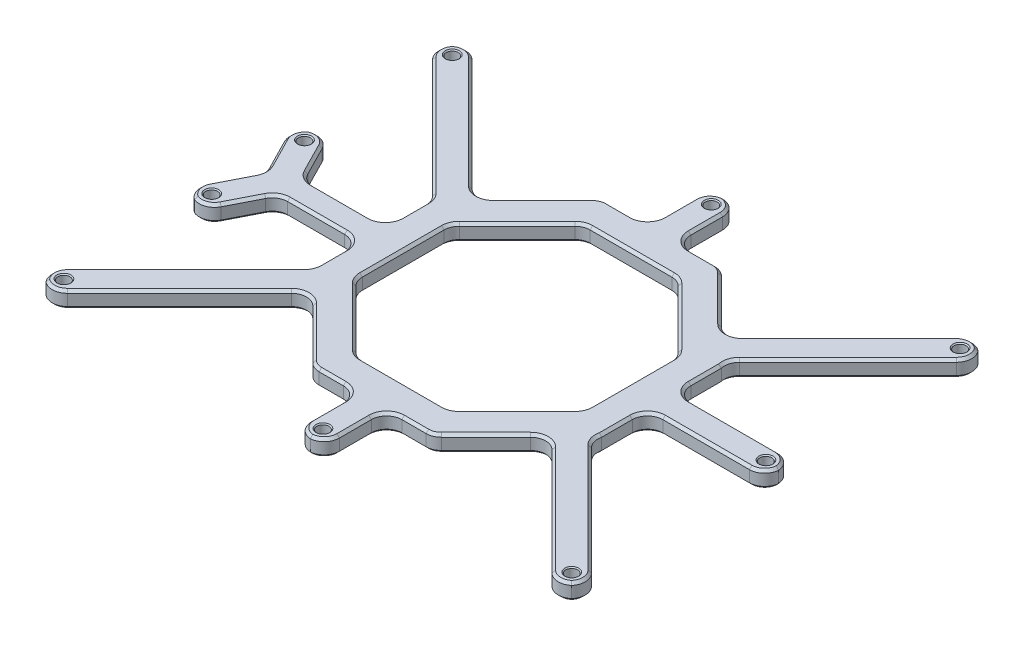
from build123d import *

# Parameters (mm, degrees)
BOSS_EXTRUDE1_DEPTH = 6.5
CUT_EXTRUDE2_START  = 6.5
SKETCH1_3_R         = 2.35
CUT_EXTRUDE2_DEPTH  = 4
SKETCH2_R           = 2.35
CUT_EXTRUDE1_DEPTH  = 4
FILLET1_START       = -1
FILLET1_DEPTH       = 8
FILLET1_2_DEPTH     = 6.5
CHAMFER1_SIZE       = 0.4
CHAMFER2_SIZE       = 1


with BuildPart() as part:
    # Sketch1 → Boss-Extrude1 (new body)
    with BuildSketch(Plane(origin=(0, 0, 0), x_dir=(1, 0, 0), z_dir=(0, 1, 0))):
        Polygon((49.938523544, -21.19426647), (31.907300624, -21.19426647), (31.907300624, 3.371336017), (20.907300624, 3.371336017), (20.907300624, -21.19426647), (2.876077704, -21.19426647), (-22.623922296, -46.69426647), (-75.114145985, 5.795957219), (-82.892320578, -1.982217374), (-30.402096889, -54.472441063), (-30.402096889, -73.003663983), (-62.531331672, -73.003663983), (-72.841447163, -52.800046269), (-82.639406134, -57.800046269), (-72.329290643, -78.003663983), (-82.639406134, -98.207281697), (-72.841447163, -103.207281697), (-62.531331672, -83.003663983), (-30.402096889, -83.003663983), (-30.402096889, -101.534886904), (-82.892320578, -154.025110593), (-75.114145985, -161.803285186), (-22.623922296, -109.313061497), (2.876077704, -134.813061497), (20.907300624, -134.813061497), (20.907300624, -159.378663983), (31.907300624, -159.378663983), (31.907300624, -134.813061497), (49.938523544, -134.813061497), (73.438523544, -111.313061497), (123.928747234, -161.803285186), (131.706921827, -154.025110593), (81.216698138, -103.534886904), (83.216698138, -101.534886904), (83.216698138, -83.503663983), (129.282300624, -83.503663983), (129.282300624, -72.503663983), (83.216698138, -72.503663983), (83.216698138, -54.472441063), (81.216698138, -52.472441063), (131.706921827, -1.982217374), (123.928747234, 5.795957219), (73.438523544, -44.69426647), align=None)
        Polygon((7.846640452, -33.19426647), (44.967960796, -33.19426647), (71.216698138, -59.443003812), (71.216698138, -96.564324155), (44.967960796, -122.813061497), (7.846640452, -122.813061497), (-18.402096889, -96.564324155), (-18.402096889, -59.443003812), align=None, mode=Mode.SUBTRACT)
    extrude(amount=BOSS_EXTRUDE1_DEPTH)

    # Sketch1<3> → Cut-Extrude2 (cut)
    with BuildSketch(Plane(origin=(0, 0, 0), x_dir=(1, 0, 0), z_dir=(0, 1, 0)).offset(CUT_EXTRUDE2_START)):
        with Locations(Location((-75.467699376, -96.253663983, 0), (0, 0, 270))):
            Circle(SKETCH1_3_R)
        with Locations(Location((-75.467699376, -154.378663983, 0), (0, 0, 270))):
            Circle(SKETCH1_3_R)
        with Locations(Location((26.407300624, -154.378663983, 0), (0, 0, 270))):
            Circle(SKETCH1_3_R)
        with Locations(Location((124.282300624, -154.378663983, 0), (0, 0, 270))):
            Circle(SKETCH1_3_R)
        with Locations(Location((124.282300624, -78.003663983, 0), (0, 0, 270))):
            Circle(SKETCH1_3_R)
        with Locations(Location((124.282300624, -1.628663983, 0), (0, 0, 270))):
            Circle(SKETCH1_3_R)
        with Locations(Location((26.407300624, -1.628663983, 0), (0, 0, 270))):
            Circle(SKETCH1_3_R)
        with Locations(Location((-75.467699376, -1.628663983, 0), (0, 0, 270))):
            Circle(SKETCH1_3_R)
        with Locations(Location((-75.467699376, -59.753663983, 0), (0, 0, 270))):
            Circle(SKETCH1_3_R)
    extrude(amount=-CUT_EXTRUDE2_DEPTH, mode=Mode.SUBTRACT)

    # Sketch2 → Cut-Extrude1 (cut)
    with BuildSketch(Plane.XZ):
        with Locations(Location((-7.920615679, 115.53108674, 0), (0, 0, 270))):
            Circle(SKETCH2_R)
        with Locations(Location((89.06313323, 78.003663983, 0), (0, 0, 270))):
            Circle(SKETCH2_R)
        with Locations(Location((-7.920615679, 40.476241227, 0), (0, 0, 270))):
            Circle(SKETCH2_R)
    extrude(amount=-CUT_EXTRUDE1_DEPTH, mode=Mode.SUBTRACT)

    # Fillet1: read off the stored shape, not the designer's step
    # Fillet1 outline → Fillet1 (cut)
    with BuildSketch(Plane(origin=(0, 0, 0), x_dir=(1, 0, 0), z_dir=(0, 1, 0)).offset(FILLET1_START)):
        with BuildLine():
            ThreePointArc((26.407300624, -159.357794355), (22.491420191, -157.440683186), (20.907300624, -153.378663983))
            Line((20.907300624, -153.378663983), (20.907300624, -159.378663983))
            Line((20.907300624, -159.378663983), (31.907300624, -159.378663983))
            Line((31.907300624, -159.378663983), (31.907300624, -153.378663983))
            ThreePointArc((31.907300624, -153.378663983), (30.323181057, -157.440683186), (26.407300624, -159.357794355))
        make_face()
        with BuildLine():
            Line((2.876077704, -134.813061497), (5.361359078, -134.813061497))
            ThreePointArc((5.361359078, -134.813061497), (3.065258484, -134.356338692), (1.118718391, -133.055702184))
            Line((1.118718391, -133.055702184), (2.876077704, -134.813061497))
        make_face()
        with BuildLine():
            Line((-75.114145985, -161.803285186), (-70.871505298, -157.560644499))
            ThreePointArc((-70.871505298, -157.560644499), (-74.863928309, -159.312784134), (-78.988476226, -157.899440833))
            ThreePointArc((-78.988476226, -157.899440833), (-80.401819526, -153.774892917), (-78.649679891, -149.782469906))
            Line((-78.649679891, -149.782469906), (-82.892320578, -154.025110593))
            Line((-82.892320578, -154.025110593), (-75.114145985, -161.803285186))
        make_face()
        with BuildLine():
            ThreePointArc((51.695882857, -133.055702184), (49.749342764, -134.356338692), (47.45324217, -134.813061497))
            Line((47.45324217, -134.813061497), (49.938523544, -134.813061497))
            Line((49.938523544, -134.813061497), (51.695882857, -133.055702184))
        make_face()
        with BuildLine():
            ThreePointArc((127.803077474, -157.899440833), (123.678529558, -159.312784134), (119.686106547, -157.560644499))
            Line((119.686106547, -157.560644499), (123.928747234, -161.803285186))
            Line((123.928747234, -161.803285186), (131.706921827, -154.025110593))
            Line((131.706921827, -154.025110593), (127.46428114, -149.782469906))
            ThreePointArc((127.46428114, -149.782469906), (129.216420775, -153.774892917), (127.803077474, -157.899440833))
        make_face()
        with BuildLine():
            Line((-72.841447163, -103.207281697), (-70.114174436, -97.86294044))
            ThreePointArc((-70.114174436, -97.86294044), (-73.371559393, -100.761022227), (-77.730940454, -100.688692628))
            ThreePointArc((-77.730940454, -100.688692628), (-80.347493179, -97.201130924), (-79.912133407, -92.86294044))
            Line((-79.912133407, -92.86294044), (-82.639406134, -98.207281697))
            Line((-82.639406134, -98.207281697), (-72.841447163, -103.207281697))
        make_face()
        with BuildLine():
            ThreePointArc((129.261430996, -78.003663983), (127.344319827, -81.919544416), (123.282300624, -83.503663983))
            Line((123.282300624, -83.503663983), (129.282300624, -83.503663983))
            Line((129.282300624, -83.503663983), (129.282300624, -72.503663983))
            Line((129.282300624, -72.503663983), (123.282300624, -72.503663983))
            ThreePointArc((123.282300624, -72.503663983), (127.344319827, -74.08778355), (129.261430996, -78.003663983))
        make_face()
        with BuildLine():
            Line((-82.639406134, -57.800046269), (-79.912133407, -63.144387526))
            ThreePointArc((-79.912133407, -63.144387526), (-80.347493179, -58.806197043), (-77.730940454, -55.318635339))
            ThreePointArc((-77.730940454, -55.318635339), (-73.371559394, -55.24630574), (-70.114174436, -58.144387526))
            Line((-70.114174436, -58.144387526), (-72.841447163, -52.800046269))
            Line((-72.841447163, -52.800046269), (-82.639406134, -57.800046269))
        make_face()
        with BuildLine():
            ThreePointArc((127.803077474, 1.892112867), (129.216420775, -2.23243505), (127.46428114, -6.224858061))
            Line((127.46428114, -6.224858061), (131.706921827, -1.982217374))
            Line((131.706921827, -1.982217374), (123.928747234, 5.795957219))
            Line((123.928747234, 5.795957219), (119.686106547, 1.553316532))
            ThreePointArc((119.686106547, 1.553316532), (123.678529558, 3.305456167), (127.803077474, 1.892112867))
        make_face()
        with BuildLine():
            Line((-82.892320578, -1.982217374), (-78.649679891, -6.224858061))
            ThreePointArc((-78.649679891, -6.224858061), (-80.401819526, -2.23243505), (-78.988476226, 1.892112867))
            ThreePointArc((-78.988476226, 1.892112867), (-74.863928309, 3.305456167), (-70.871505298, 1.553316532))
            Line((-70.871505298, 1.553316532), (-75.114145985, 5.795957219))
            Line((-75.114145985, 5.795957219), (-82.892320578, -1.982217374))
        make_face()
        with BuildLine():
            ThreePointArc((47.45324217, -21.19426647), (49.749342764, -21.650989275), (51.695882857, -22.951625783))
            Line((51.695882857, -22.951625783), (49.938523544, -21.19426647))
            Line((49.938523544, -21.19426647), (47.45324217, -21.19426647))
        make_face()
        with BuildLine():
            ThreePointArc((26.407300624, 3.350466388), (30.323181057, 1.433355219), (31.907300624, -2.628663983))
            Line((31.907300624, -2.628663983), (31.907300624, 3.371336017))
            Line((31.907300624, 3.371336017), (20.907300624, 3.371336017))
            Line((20.907300624, 3.371336017), (20.907300624, -2.628663983))
            ThreePointArc((20.907300624, -2.628663983), (22.491420191, 1.433355219), (26.407300624, 3.350466388))
        make_face()
        with BuildLine():
            Line((2.876077704, -21.19426647), (1.118718391, -22.951625783))
            ThreePointArc((1.118718391, -22.951625783), (3.065258484, -21.650989275), (5.361359078, -21.19426647))
            Line((5.361359078, -21.19426647), (2.876077704, -21.19426647))
        make_face()
    extrude(amount=FILLET1_DEPTH, mode=Mode.SUBTRACT)

    # Fillet1 2 outline → Fillet1 2 (add)
    with BuildSketch(Plane(origin=(0, 0, 0), x_dir=(1, 0, 0), z_dir=(0, 1, 0))):
        with BuildLine():
            ThreePointArc((10.331921827, -122.813061497), (8.035821233, -122.356338692), (6.08928114, -121.055702184))
            Line((6.08928114, -121.055702184), (7.846640452, -122.813061497))
            Line((7.846640452, -122.813061497), (10.331921827, -122.813061497))
        make_face()
        with BuildLine():
            Line((-18.402096889, -96.564324155), (-16.644737576, -98.321683468))
            ThreePointArc((-16.644737576, -98.321683468), (-17.945374084, -96.375143375), (-18.402096889, -94.079042781))
            Line((-18.402096889, -94.079042781), (-18.402096889, -96.564324155))
        make_face()
        with BuildLine():
            ThreePointArc((46.725320109, -121.055702184), (44.778780016, -122.356338692), (42.482679422, -122.813061497))
            Line((42.482679422, -122.813061497), (44.967960796, -122.813061497))
            Line((44.967960796, -122.813061497), (46.725320109, -121.055702184))
        make_face()
        with BuildLine():
            Line((-18.402096889, -59.443003812), (-18.402096889, -61.928285186))
            ThreePointArc((-18.402096889, -61.928285186), (-17.945374084, -59.632184592), (-16.644737576, -57.685644499))
            Line((-16.644737576, -57.685644499), (-18.402096889, -59.443003812))
        make_face()
        with BuildLine():
            ThreePointArc((71.216698138, -94.079042781), (70.759975333, -96.375143375), (69.459338825, -98.321683468))
            Line((69.459338825, -98.321683468), (71.216698138, -96.564324155))
            Line((71.216698138, -96.564324155), (71.216698138, -94.079042781))
        make_face()
        with BuildLine():
            Line((7.846640452, -33.19426647), (6.08928114, -34.951625783))
            ThreePointArc((6.08928114, -34.951625783), (8.035821233, -33.650989275), (10.331921827, -33.19426647))
            Line((10.331921827, -33.19426647), (7.846640452, -33.19426647))
        make_face()
        with BuildLine():
            ThreePointArc((69.459338825, -57.685644499), (70.759975333, -59.632184592), (71.216698138, -61.928285186))
            Line((71.216698138, -61.928285186), (71.216698138, -59.443003812))
            Line((71.216698138, -59.443003812), (69.459338825, -57.685644499))
        make_face()
        with BuildLine():
            Line((44.967960796, -33.19426647), (42.482679422, -33.19426647))
            ThreePointArc((42.482679422, -33.19426647), (44.778780016, -33.650989275), (46.725320109, -34.951625783))
            Line((46.725320109, -34.951625783), (44.967960796, -33.19426647))
        make_face()
        with BuildLine():
            ThreePointArc((14.907300624, -134.813061497), (19.149941311, -136.57042081), (20.907300624, -140.813061497))
            Line((20.907300624, -140.813061497), (20.907300624, -134.813061497))
            Line((20.907300624, -134.813061497), (14.907300624, -134.813061497))
        make_face()
        with BuildLine():
            ThreePointArc((-26.866562983, -113.555702184), (-22.623922296, -111.798342871), (-18.381281609, -113.555702184))
            Line((-18.381281609, -113.555702184), (-22.623922296, -109.313061497))
            Line((-22.623922296, -109.313061497), (-26.866562983, -113.555702184))
        make_face()
        with BuildLine():
            Line((31.907300624, -134.813061497), (31.907300624, -140.813061497))
            ThreePointArc((31.907300624, -140.813061497), (33.664659937, -136.57042081), (37.907300624, -134.813061497))
            Line((37.907300624, -134.813061497), (31.907300624, -134.813061497))
        make_face()
        with BuildLine():
            Line((73.438523544, -111.313061497), (69.195882857, -115.555702184))
            ThreePointArc((69.195882857, -115.555702184), (73.438523545, -113.798342871), (77.681164232, -115.555702184))
            Line((77.681164232, -115.555702184), (73.438523544, -111.313061497))
        make_face()
        with BuildLine():
            ThreePointArc((-30.402096889, -99.049605529), (-30.858819694, -101.345706123), (-32.159456202, -103.292246216))
            Line((-32.159456202, -103.292246216), (-30.402096889, -101.534886904))
            Line((-30.402096889, -101.534886904), (-30.402096889, -99.049605529))
        make_face()
        with BuildLine():
            ThreePointArc((-36.402096889, -83.003663983), (-32.159456202, -84.761023296), (-30.402096889, -89.003663983))
            Line((-30.402096889, -89.003663983), (-30.402096889, -83.003663983))
            Line((-30.402096889, -83.003663983), (-36.402096889, -83.003663983))
        make_face()
        with BuildLine():
            ThreePointArc((-64.201438315, -86.276391256), (-61.990494865, -83.886846791), (-58.857097058, -83.003663983))
            Line((-58.857097058, -83.003663983), (-62.531331672, -83.003663983))
            Line((-62.531331672, -83.003663983), (-64.201438315, -86.276391256))
        make_face()
        with BuildLine():
            Line((81.216698138, -103.534886904), (84.818164887, -107.136353653))
            ThreePointArc((84.818164887, -107.136353653), (83.29194699, -104.543037263), (83.216698138, -101.534886904))
            Line((83.216698138, -101.534886904), (81.216698138, -103.534886904))
        make_face()
        with BuildLine():
            Line((83.216698138, -83.503663983), (83.216698138, -89.503663983))
            ThreePointArc((83.216698138, -89.503663983), (84.974057451, -85.261023295), (89.216698138, -83.503663983))
            Line((89.216698138, -83.503663983), (83.216698138, -83.503663983))
        make_face()
        with BuildLine():
            ThreePointArc((-73.721046179, -75.276391256), (-73.065387435, -78.003663983), (-73.721046179, -80.730936711))
            Line((-73.721046179, -80.730936711), (-72.329290643, -78.003663983))
            Line((-72.329290643, -78.003663983), (-73.721046179, -75.276391256))
        make_face()
        with BuildLine():
            Line((83.216698138, -72.503663983), (89.216698138, -72.503663983))
            ThreePointArc((89.216698138, -72.503663983), (84.97405745, -70.74630467), (83.216698138, -66.503663983))
            Line((83.216698138, -66.503663983), (83.216698138, -72.503663983))
        make_face()
        with BuildLine():
            Line((81.216698138, -52.472441063), (83.216698138, -54.472441063))
            ThreePointArc((83.216698138, -54.472441063), (83.29194699, -51.464290704), (84.818164887, -48.870974313))
            Line((84.818164887, -48.870974313), (81.216698138, -52.472441063))
        make_face()
        with BuildLine():
            ThreePointArc((-58.857097058, -73.003663983), (-61.990494865, -72.120481176), (-64.201438315, -69.730936711))
            Line((-64.201438315, -69.730936711), (-62.531331672, -73.003663983))
            Line((-62.531331672, -73.003663983), (-58.857097058, -73.003663983))
        make_face()
        with BuildLine():
            ThreePointArc((-30.402096889, -67.003663983), (-32.159456202, -71.24630467), (-36.402096889, -73.003663983))
            Line((-36.402096889, -73.003663983), (-30.402096889, -73.003663983))
            Line((-30.402096889, -73.003663983), (-30.402096889, -67.003663983))
        make_face()
        with BuildLine():
            ThreePointArc((-32.159456202, -52.71508175), (-30.858819694, -54.661621843), (-30.402096889, -56.957722437))
            Line((-30.402096889, -56.957722437), (-30.402096889, -54.472441063))
            Line((-30.402096889, -54.472441063), (-32.159456202, -52.71508175))
        make_face()
        with BuildLine():
            Line((73.438523544, -44.69426647), (77.681164232, -40.451625783))
            ThreePointArc((77.681164232, -40.451625783), (73.438523545, -42.208985096), (69.195882857, -40.451625783))
            Line((69.195882857, -40.451625783), (73.438523544, -44.69426647))
        make_face()
        with BuildLine():
            Line((31.907300624, -21.19426647), (37.907300624, -21.19426647))
            ThreePointArc((37.907300624, -21.19426647), (33.664659937, -19.436907157), (31.907300624, -15.19426647))
            Line((31.907300624, -15.19426647), (31.907300624, -21.19426647))
        make_face()
        with BuildLine():
            ThreePointArc((-18.381281609, -42.451625783), (-22.623922296, -44.208985096), (-26.866562983, -42.451625783))
            Line((-26.866562983, -42.451625783), (-22.623922296, -46.69426647))
            Line((-22.623922296, -46.69426647), (-18.381281609, -42.451625783))
        make_face()
        with BuildLine():
            ThreePointArc((20.907300624, -15.19426647), (19.149941311, -19.436907157), (14.907300624, -21.19426647))
            Line((14.907300624, -21.19426647), (20.907300624, -21.19426647))
            Line((20.907300624, -21.19426647), (20.907300624, -15.19426647))
        make_face()
    extrude(amount=FILLET1_2_DEPTH)

    # Chamfer1
    chamfer1_edges = [part.edges().sort_by_distance(p)[0] for p in [
        (-75.467699376, 6.5, 57.403663983),
        (-75.467699376, 6.5, -0.721336017),
        (26.407300624, 6.5, -0.721336017),
        (124.282300624, 6.5, -0.721336017),
        (124.282300624, 6.5, 75.653663983),
        (124.282300624, 6.5, 152.028663983),
        (26.407300624, 6.5, 152.028663983),
        (-75.467699376, 6.5, 152.028663983),
        (-75.467699376, 6.5, 93.903663983),
    ]]
    chamfer(chamfer1_edges, length=CHAMFER1_SIZE)

    # Chamfer2
    chamfer2_edges = [part.edges().sort_by_distance(p)[0] for p in [
        (83.216698138, 6.5, 95.519275443),
        (-5.277728218, 0, 109.688692826),
        (-5.277728218, 6.5, 109.688692826),
        (26.407300624, 0, 122.813061497),
        (26.407300624, 6.5, 122.813061497),
        (58.092329467, 0, 109.688692826),
        (58.092329467, 6.5, 109.688692826),
        (71.216698138, 0, 78.003663983),
        (71.216698138, 6.5, 78.003663983),
        (58.092329467, 0, 46.318635141),
        (58.092329467, 6.5, 46.318635141),
        (26.407300624, 0, 33.19426647),
        (26.407300624, 6.5, 33.19426647),
        (-5.277728218, 0, 46.318635141),
        (-5.277728218, 6.5, 46.318635141),
        (-18.402096889, 0, 78.003663983),
        (-18.402096889, 6.5, 78.003663983),
        (20.907300624, 0, 147.09586274),
        (20.907300624, 6.5, 147.09586274),
        (10.134329851, 0, 134.813061497),
        (10.134329851, 6.5, 134.813061497),
        (42.680271397, 0, 134.813061497),
        (42.680271397, 6.5, 134.813061497),
        (31.907300624, 0, 147.09586274),
        (31.907300624, 6.5, 147.09586274),
        (-76.816589793, 0, 86.796938576),
        (-76.816589793, 0, 69.210389391),
        (-67.157806375, 0, 63.937662118),
        (-47.629596973, 0, 73.003663983),
        (-30.402096889, 0, 61.98069321),
        (-55.404568047, 0, 29.469969906),
        (-48.869034141, 0, 20.449154626),
        (-8.631281609, 0, 32.701625783),
        (10.134329851, 0, 21.19426647),
        (20.907300624, 0, 8.911465226),
        (31.907300624, 0, 8.911465226),
        (42.680271397, 0, 21.19426647),
        (60.445882857, 0, 31.701625783),
        (98.683635389, 0, 19.449154625),
        (106.141223014, 0, 27.547916187),
        (83.216698138, 0, 60.488052523),
        (106.249499381, 0, 72.503663983),
        (106.249499381, 0, 83.503663983),
        (106.141223013, 0, 128.45941178),
        (98.683635389, 0, 136.558173342),
        (60.445882857, 0, 124.305702184),
        (-8.631281609, 0, 123.305702184),
        (-48.869034141, 0, 135.558173341),
        (-55.404568047, 0, 126.537358061),
        (-30.402096889, 0, 94.026634756),
        (-47.629596973, 0, 83.003663983),
        (-67.157806375, 0, 92.069665848),
        (-80.401819526, 0, 2.23243505),
        (-74.863928309, 0, -3.305456167),
        (-80.347493179, 0, 58.806197043),
        (-73.371559394, 0, 55.24630574),
        (-80.347493179, 0, 97.201130924),
        (-73.371559393, 0, 100.761022227),
        (-80.401819526, 0, 153.774892917),
        (-74.863928309, 0, 159.312784134),
        (30.323181057, 0, 157.440683186),
        (22.491420191, 0, 157.440683186),
        (123.678529558, 0, 159.312784134),
        (129.216420775, 0, 153.774892917),
        (127.344319827, 0, 81.919544416),
        (127.344319827, 0, 74.08778355),
        (129.216420775, 0, 2.23243505),
        (123.678529558, 0, -3.305456167),
        (30.323181057, 0, -1.433355219),
        (22.491420191, 0, -1.433355219),
        (3.065258484, 0, 21.650989275),
        (49.749342764, 0, 21.650989275),
        (49.749342764, 0, 134.356338692),
        (3.065258484, 0, 134.356338692),
        (-8.631281609, 6.5, 123.305702184),
        (-47.629596973, 6.5, 73.003663983),
        (-67.157806375, 6.5, 63.937662118),
        (-76.816589793, 6.5, 69.210389391),
        (-76.816589793, 6.5, 86.796938576),
        (-67.157806375, 6.5, 92.069665848),
        (-47.629596973, 6.5, 83.003663983),
        (-30.402096889, 6.5, 94.026634756),
        (-55.404568047, 6.5, 126.537358061),
        (-48.869034141, 6.5, 135.558173341),
        (60.445882857, 6.5, 124.305702184),
        (98.683635389, 6.5, 136.558173342),
        (106.141223013, 6.5, 128.45941178),
        (106.249499381, 6.5, 83.503663983),
        (106.249499381, 6.5, 72.503663983),
        (83.216698138, 6.5, 60.488052523),
        (106.141223014, 6.5, 27.547916187),
        (98.683635389, 6.5, 19.449154625),
        (60.445882857, 6.5, 31.701625783),
        (42.680271397, 6.5, 21.19426647),
        (31.907300624, 6.5, 8.911465226),
        (20.907300624, 6.5, 8.911465226),
        (10.134329851, 6.5, 21.19426647),
        (-8.631281609, 6.5, 32.701625783),
        (-48.869034141, 6.5, 20.449154626),
        (-55.404568047, 6.5, 29.469969906),
        (-30.402096889, 6.5, 61.98069321),
        (-80.401819526, 6.5, 2.23243505),
        (-74.863928309, 6.5, -3.305456167),
        (-80.347493179, 6.5, 58.806197043),
        (-73.371559394, 6.5, 55.24630574),
        (-80.347493179, 6.5, 97.201130924),
        (-73.371559393, 6.5, 100.761022227),
        (-80.401819526, 6.5, 153.774892917),
        (-74.863928309, 6.5, 159.312784134),
        (30.323181057, 6.5, 157.440683186),
        (22.491420191, 6.5, 157.440683186),
        (123.678529558, 6.5, 159.312784134),
        (129.216420775, 6.5, 153.774892917),
        (127.344319827, 6.5, 81.919544416),
        (127.344319827, 6.5, 74.08778355),
        (129.216420775, 6.5, 2.23243505),
        (123.678529558, 6.5, -3.305456167),
        (30.323181057, 6.5, -1.433355219),
        (22.491420191, 6.5, -1.433355219),
        (3.065258484, 6.5, 21.650989275),
        (49.749342764, 6.5, 21.650989275),
        (49.749342764, 6.5, 134.356338692),
        (3.065258484, 6.5, 134.356338692),
        (8.035821233, 0, 122.356338692),
        (8.035821233, 6.5, 122.356338692),
        (44.778780016, 0, 122.356338692),
        (44.778780016, 6.5, 122.356338692),
        (70.759975333, 0, 96.375143375),
        (70.759975333, 6.5, 96.375143375),
        (70.759975333, 0, 59.632184592),
        (70.759975333, 6.5, 59.632184592),
        (44.778780016, 0, 33.650989275),
        (44.778780016, 6.5, 33.650989275),
        (8.035821233, 0, 33.650989275),
        (8.035821233, 6.5, 33.650989275),
        (-17.945374084, 0, 59.632184592),
        (-17.945374084, 6.5, 59.632184592),
        (-17.945374084, 0, 96.375143375),
        (-17.945374084, 6.5, 96.375143375),
        (19.149941311, 0, 136.57042081),
        (19.149941311, 6.5, 136.57042081),
        (33.664659937, 0, 136.57042081),
        (33.664659937, 6.5, 136.57042081),
        (73.438523545, 0, 113.798342871),
        (73.438523545, 6.5, 113.798342871),
        (83.29194699, 0, 104.543037263),
        (83.29194699, 6.5, 104.543037263),
        (84.97405745, 0, 85.261023295),
        (84.97405745, 6.5, 85.261023295),
        (84.97405745, 0, 70.74630467),
        (84.97405745, 6.5, 70.74630467),
        (83.29194699, 0, 51.464290704),
        (83.29194699, 6.5, 51.464290704),
        (73.438523545, 0, 42.208985096),
        (73.438523545, 6.5, 42.208985096),
        (33.664659937, 0, 19.436907157),
        (33.664659937, 6.5, 19.436907157),
        (19.149941311, 0, 19.436907157),
        (19.149941311, 6.5, 19.436907157),
        (-22.623922296, 0, 44.208985096),
        (-22.623922296, 6.5, 44.208985096),
        (-30.858819694, 0, 54.661621843),
        (-30.858819694, 6.5, 54.661621843),
        (-30.858819694, 0, 101.345706123),
        (-30.858819694, 6.5, 101.345706123),
        (-22.623922296, 0, 111.798342871),
        (-22.623922296, 6.5, 111.798342871),
        (-32.159456202, 0, 71.24630467),
        (-32.159456202, 6.5, 71.24630467),
        (-32.159456202, 0, 84.761023296),
        (-32.159456202, 6.5, 84.761023296),
        (-61.990494865, 0, 72.120481176),
        (-61.990494865, 6.5, 72.120481176),
        (-61.990494865, 0, 83.886846791),
        (-61.990494865, 6.5, 83.886846791),
        (-73.065387435, 0, 78.003663983),
        (-73.065387435, 6.5, 78.003663983),
        (83.216698138, 0, 95.519275443),
    ]]
    chamfer(chamfer2_edges, length=CHAMFER2_SIZE - 0.0001)  # a hair under: the kernel refuses the full size


solid = part.part
